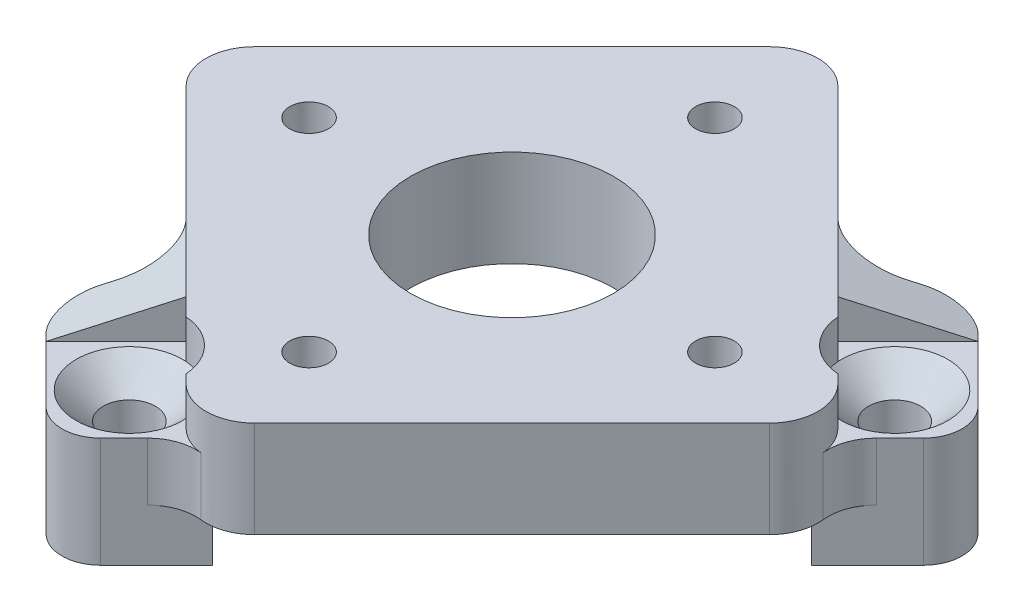
from build123d import *

# Parameters (mm, degrees)
SKETCH1_R                                      = 0.5
SKETCH1_R_2                                    = 5.25
BOSS_EXTRUDE1_DEPTH                            = 5
SKETCH3_R                                      = 1.3
BOSS_EXTRUDE4_DEPTH                            = 5.7
BOSS_EXTRUDE6_DEPTH                            = 2.473491095
FILLET1_R                                      = 2.5
FILLET2_R                                      = 2
F_2_0MM_DOWEL_HOLE1_D                          = 2
F_2_0MM_DOWEL_HOLE1_DEPTH                      = 42.93
F_2_0MM_DOWEL_HOLE1_TIP                        = 0.600860619
CSK_FOR_M2_5_FLAT_HEAD_MACHINE_SCREW1_AT_COUNT = 2
CSK_FOR_M2_5_FLAT_HEAD_MACHINE_SCREW1_AT_PITCH = 28
SKETCH14_R                                     = 2.75
CUT_EXTRUDE1_DEPTH                             = 27.54536008


with BuildPart() as part:
    # Sketch1 → Boss-Extrude1 (new body)
    with BuildSketch(Plane(origin=(0, 0, 0), x_dir=(1, 0, 0), z_dir=(0, 1, 0))):
        with BuildLine():
            Line((1.767766953, 15.096194078), (15.096194078, 1.767766953))
            ThreePointArc((15.096194078, 1.767766953), (15.828427125, 0), (15.096194078, -1.767766953))
            Line((15.096194078, -1.767766953), (1.767766953, -15.096194078))
            ThreePointArc((1.767766953, -15.096194078), (0, -15.828427125), (-1.767766953, -15.096194078))
            Line((-1.767766953, -15.096194078), (-15.096194078, -1.767766953))
            ThreePointArc((-15.096194078, -1.767766953), (-15.828427125, 0), (-15.096194078, 1.767766953))
            Line((-15.096194078, 1.767766953), (-1.767766953, 15.096194078))
            ThreePointArc((-1.767766953, 15.096194078), (0, 15.828427125), (1.767766953, 15.096194078))
        make_face()
        with Locations(Location((0, 10.5, 0), (0, 0, 270))):
            Circle(SKETCH1_R, mode=Mode.SUBTRACT)
        with Locations(Location((0, -10.5, 0), (0, 0, 270))):
            Circle(SKETCH1_R, mode=Mode.SUBTRACT)
        with Locations(Location((10.5, 0, 0), (0, 0, 270))):
            Circle(SKETCH1_R, mode=Mode.SUBTRACT)
        with Locations(Location((-10.5, 0, 0), (0, 0, 270))):
            Circle(SKETCH1_R, mode=Mode.SUBTRACT)
        with Locations(Location((0, 0, 0), (0, 0, 270))):
            Circle(SKETCH1_R_2, mode=Mode.SUBTRACT)
    extrude(amount=BOSS_EXTRUDE1_DEPTH)

    # Sketch3 → Boss-Extrude4 (add)
    # profile 1 of 4: a face of its own
    with BuildSketch(Plane(origin=(0, -2.7, 0), x_dir=(1, 0, 0), z_dir=(0, 1, 0))):
        Polygon((-4.949747468, -10.537489101), (-0.637994164, -14.849242405), (-4.949747468, -19.160995709), (-9.261500772, -14.849242405), align=None)
        with Locations(Location((-4.949747468, -14.849242405, 0), (0, 0, 90))):
            Circle(SKETCH3_R, mode=Mode.SUBTRACT)
    # profile 2 of 4: a face of its own
    with BuildSketch(Plane(origin=(0, -2.7, 0), x_dir=(1, 0, 0), z_dir=(0, 1, 0))):
        Polygon((-6.717514421, -8.769722148), (-11.029267725, -13.081475452), (-9.261500772, -14.849242405), (-4.949747468, -10.537489101), align=None)
    # profile 3 of 4: a face of its own
    with BuildSketch(Plane(origin=(0, -2.7, 0), x_dir=(1, 0, 0), z_dir=(0, 1, 0))):
        Polygon((19.160995709, 4.949747468), (14.849242405, 9.261500772), (10.537489101, 4.949747468), (14.849242405, 0.637994164), align=None)
        with Locations(Location((14.849242405, 4.949747468, 0), (0, 0, 90))):
            Circle(SKETCH3_R, mode=Mode.SUBTRACT)
    # profile 4 of 4: a face of its own
    with BuildSketch(Plane(origin=(0, -2.7, 0), x_dir=(1, 0, 0), z_dir=(0, 1, 0))):
        Polygon((13.081475452, 11.029267725), (14.849242405, 9.261500772), (10.537489101, 4.949747468), (8.769722148, 6.717514421), align=None)
    extrude(amount=BOSS_EXTRUDE4_DEPTH)


with BuildPart() as boss_extrude6_tool:
    # Sketch7 → Boss-Extrude6 (new body)
    with BuildSketch(Plane(origin=(2.775126076, -2.11e-07, 2.775126076), x_dir=(0.7071067811865474, 0, -0.7071067811865478), z_dir=(0.7071067811865468, -5.372690076738491e-08, 0.7071067811865464))):
        Polygon((11.924621202, 5.000000506), (17.04887, 3.00000054), (11.924621202, 3.000000506), align=None)
        Polygon((-11.924621202, 5.000000506), (-17.04887, 3.00000054), (-11.924621202, 3.000000506), align=None)
    extrude(amount=-BOSS_EXTRUDE6_DEPTH)


with BuildPart() as part_1:
    add(part.part)


with BuildPart() as part_2:
    # Boss-Extrude6: joined with boss_extrude6_tool
    add(part_1.part.fuse(boss_extrude6_tool.part, tol=0.00001))

    # Fillet1
    fillet1_edges = [part_2.edges().sort_by_distance(p)[0] for p in [
        (-7.405876652, 1.5, 9.458084379),
        (-1.270359497, 1.5, 15.481607737),
        (9.458084379, 1.5, -7.405876652),
        (15.481607737, 1.5, -1.270359497),
    ]]
    fillet(fillet1_edges, radius=FILLET1_R)

    # Fillet2
    # the kernel refuses this fillet: 2 mm, written as the material it takes off along each edge
    with BuildSketch(Plane(origin=(-4.949747468, -7.7, 19.160995709), x_dir=(0.7071067811865477, 0, -0.7071067811865475), z_dir=(0, 1, 0)), Plane(origin=(13.081475452, -7.7, -11.029267725), x_dir=(-0.7071067811865471, 0, 0.707106781186548), z_dir=(0, 1, 0)), Plane(origin=(19.160995709, -7.7, -4.949747468), x_dir=(-0.7071067811865482, 0, -0.7071067811865469), z_dir=(0, 1, 0))) as fillet2_piece_1:
        with BuildLine():
            CenterArc((FILLET2_R, FILLET2_R), FILLET2_R, 180, 90)
            Line((0, FILLET2_R), (0, 0))
            Line((0, 0), (FILLET2_R, 0))
        make_face()
    extrude(amount=15.7, mode=Mode.SUBTRACT)
    with BuildSketch(Plane(origin=(-11.029267725, -7.7, 13.081475452), x_dir=(0.7071067811865476, 0, -0.7071067811865476), z_dir=(0, 1, 0))) as fillet2_piece_2:
        with BuildLine():
            CenterArc((FILLET2_R, -FILLET2_R), FILLET2_R, 90, 90)
            Line((0, -FILLET2_R), (0, 0))
            Line((0, 0), (FILLET2_R, 0))
        make_face()
    extrude(amount=15.7, mode=Mode.SUBTRACT)

    # Ø2.0mm Dowel Hole1
    with Locations(Plane.XZ):
        with Locations((0, 10.5), (10.5, 0), (-10.5, 0), (0, -10.5)):
            Hole(F_2_0MM_DOWEL_HOLE1_D / 2, depth=F_2_0MM_DOWEL_HOLE1_DEPTH)
            with Locations((0, 0, -(F_2_0MM_DOWEL_HOLE1_DEPTH + F_2_0MM_DOWEL_HOLE1_TIP / 2))):  # 118° drill point
                Cone(0, F_2_0MM_DOWEL_HOLE1_D / 2, F_2_0MM_DOWEL_HOLE1_TIP, mode=Mode.SUBTRACT)

    # Sketch12 → CSK for M2.5 Flat Head Machine Screw1 (revolve, cut)
    with BuildSketch(Plane(origin=(-4.949747468, 3, 14.849242405), x_dir=(0, 0, 1), z_dir=(1, 0, 0))):
        Polygon((0, 0), (0, 5.7), (1.35, 5.7), (1.35, 1.4), (2.75, 0), align=None)
    csk_for_m2_5_flat_head_machine_screw1 = revolve(axis=Axis((-4.949747468, 9.35, 14.849242405), (0, -1, 0)), mode=Mode.SUBTRACT)

    # CSK for M2.5 Flat Head Machine Screw1 at: CSK for M2.5 Flat Head Machine Screw1 ×2
    with Locations(*[Vector(0.7071067811865477, 0, -0.7071067811865475) * (i * CSK_FOR_M2_5_FLAT_HEAD_MACHINE_SCREW1_AT_PITCH) for i in range(1, CSK_FOR_M2_5_FLAT_HEAD_MACHINE_SCREW1_AT_COUNT)]):
        add(csk_for_m2_5_flat_head_machine_screw1, mode=Mode.SUBTRACT)

    # Sketch14 → Cut-Extrude1 (cut, through all)
    with BuildSketch(Plane(origin=(0, 3, 0), x_dir=(1, 0, 0), z_dir=(0, 1, 0))):
        with Locations((-4.949747468, -14.849242405)):
            Circle(SKETCH14_R)
        with Locations((14.849242405, 4.949747468)):
            Circle(SKETCH14_R)
    extrude(amount=CUT_EXTRUDE1_DEPTH, mode=Mode.SUBTRACT)


solid = part_2.part
